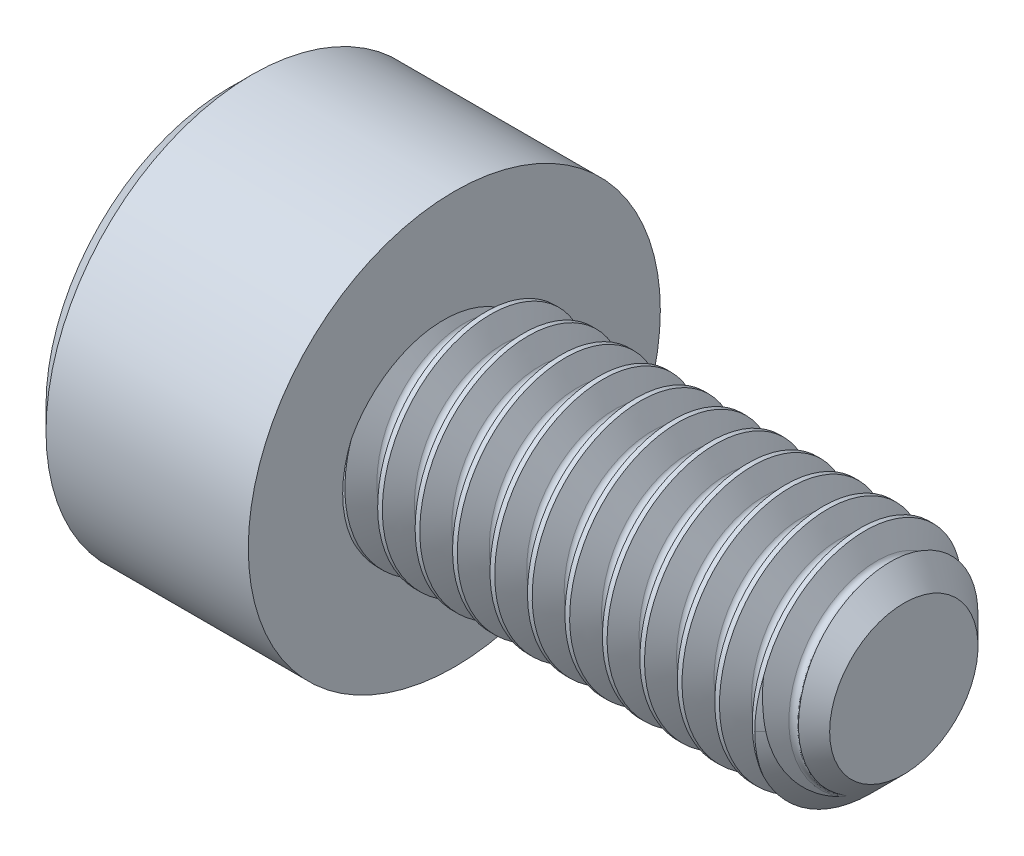
from build123d import *

# Parameters (mm, degrees)
CHAMFER1_SIZE      = 0.5
CHAMFER2_SIZE      = 0.3
CUT_EXTRUDE1_DEPTH = 2.5
CHAMFER3_SIZE      = 0.3
CUT_SWEEP1_PITCH   = 0.5
CUT_SWEEP1_TO      = 6


with BuildPart() as part:
    # Sketch1 → Revolve1 (revolve)
    with BuildSketch(Plane.XY, mode=Mode.PRIVATE) as revolve1_sk:
        Polygon((0, 0), (0, 2.75), (3, 2.75), (3, 1.49), (9, 1.49), (9, 0), align=None)
    revolve(revolve1_sk.sketch.rotate(Axis((-88.705490849, 0, 0), (1, 0, 0)), 90), axis=Axis((-88.705490849, 0, 0), (1, 0, 0)))

    # Chamfer1
    chamfer1_edges = [part.edges().sort_by_distance(p)[0] for p in [
        (9, 0, -1.49),
    ]]
    chamfer(chamfer1_edges, length=CHAMFER1_SIZE)

    # Chamfer2
    chamfer2_edges = [part.edges().sort_by_distance(p)[0] for p in [
        (0, 0, -2.75),
    ]]
    chamfer(chamfer2_edges, length=CHAMFER2_SIZE)

    # Sketch3 → Cut-Extrude1 (cut)
    with BuildSketch(Plane(origin=(0, 0, 0), x_dir=(0, 0, -1), z_dir=(1, 0, 0))):
        Polygon((-1.443375673, 0), (-0.721687836, -1.25), (0.721687836, -1.25), (1.443375673, 0), (0.721687836, 1.25), (-0.721687836, 1.25), align=None)
    extrude(amount=CUT_EXTRUDE1_DEPTH, mode=Mode.SUBTRACT)

    # Chamfer3
    chamfer3_edges = [part.edges().sort_by_distance(p)[0] for p in [
        (0, 0.625, 1.082531755),
        (0, -0.625, 1.082531755),
        (0, -1.25, 0),
        (0, -0.625, -1.082531755),
        (0, 0.625, -1.082531755),
        (0, 1.25, 0),
    ]]
    chamfer(chamfer3_edges, length=CHAMFER3_SIZE)

    # Cut-Sweep1: arcs per turn and ends read off the stored shape
    # Cut-Sweep1: the profile of Sketch8 screwed along a right-hand helix through 13 turns, 6 arcs to a turn; built about Z, then put on its axis
    cut_sweep1_z = Axis((0, 0, 0), (0, 0, 1))
    cut_sweep1_corners = [(1.219375, 0, -0.062498167), (1.6794375, 0, -0.328115375), (1.6794375, 0, 0.328115375), (1.219375, 0, 0.062498167), (1.183291667, 0, 0)]
    with BuildLine(mode=Mode.PRIVATE) as cut_sweep1_profile:
        Line(cut_sweep1_corners[0], cut_sweep1_corners[1])
        Line(cut_sweep1_corners[1], cut_sweep1_corners[2])
        Line(cut_sweep1_corners[2], cut_sweep1_corners[3])
        ThreePointArc((1.219375, 0, 0.062498167), (1.192960167, 0, 0.036083333), (1.183291667, 0, 0))
        ThreePointArc((1.183291667, 0, 0), (1.192960167, 0, -0.036083333), (1.219375, 0, -0.062498167))
    cut_sweep1_cap = Face(cut_sweep1_profile.wire())
    cut_sweep1_arcs = [((1.219375, 0, 0.062498167), (1.183291667, 0, 0.041665444), (1.183291667, 0, 0), (1, 0.8660254037844317, 1)), ((1.183291667, 0, 0), (1.183291667, 0, -0.041665444), (1.219375, 0, -0.062498167), (1, 0.8660254037844317, 1))]  # start, shoulder, end, weights
    cut_sweep1_turn_angles = [0, 30, 60, 90, 120, 150, 180, 210, 240, 270, 300, 330, 360]
    cut_sweep1_turn_weights = [1, 0.8660254037844387, 1, 0.8660254037844387, 1, 0.8660254037844387, 1, 0.8660254037844387, 1, 0.8660254037844387, 1, 0.8660254037844387, 1]
    cut_sweep1_turn_rails = [Edge.make_bspline([Vector(p[0], p[1], 0).rotate(cut_sweep1_z, cut_sweep1_turn_angles[k]) / cut_sweep1_turn_weights[k] + Vector(0, 0, p[2] + CUT_SWEEP1_PITCH * cut_sweep1_turn_angles[k] / 360) for k in range(13)], [0, 0, 0, 1, 1, 2, 2, 3, 3, 4, 4, 5, 5, 6, 6, 6], 2, cut_sweep1_turn_weights) for p in cut_sweep1_corners]
    cut_sweep1_turn_sides = [*[Face.make_surface_from_curves(cut_sweep1_turn_rails[p[0]], cut_sweep1_turn_rails[p[1]]) for p in [(0, 1), (1, 2), (2, 3)]], *[Face.make_bezier_surface([[Vector(p[j][0], p[j][1], 0).rotate(cut_sweep1_z, cut_sweep1_turn_angles[2 * i + k]) / cut_sweep1_turn_weights[2 * i + k] + Vector(0, 0, p[j][2] + CUT_SWEEP1_PITCH * cut_sweep1_turn_angles[2 * i + k] / 360) for k in range(3)] for j in range(3)], [[p[3][j] * cut_sweep1_turn_weights[2 * i + k] for k in range(3)] for j in range(3)]) for p in cut_sweep1_arcs for i in range(6)]]
    cut_sweep1_turn = Solid(Shell([*cut_sweep1_turn_sides, cut_sweep1_cap, cut_sweep1_cap.rotate(cut_sweep1_z, 360).moved(Location((0, 0, CUT_SWEEP1_PITCH * 360 / 360)))]))
    cut_sweep1_each = [*[cut_sweep1_turn.moved(Location((0, 0, CUT_SWEEP1_PITCH * i))) for i in range(13)]]
    add(Plane(origin=(9, 0, 0), x_dir=(0, 0, -1), z_dir=(-1, 0, 0)) * split(Compound([cut_sweep1_each[i] for i in range(0, 13, 2)]), bisect_by=Plane.XY.offset(CUT_SWEEP1_TO), keep=Keep.BOTTOM, mode=Mode.PRIVATE), mode=Mode.SUBTRACT)
    add(Plane(origin=(9, 0, 0), x_dir=(0, 0, -1), z_dir=(-1, 0, 0)) * split(Compound([cut_sweep1_each[i] for i in range(1, 13, 2)]), bisect_by=Plane.XY.offset(CUT_SWEEP1_TO), keep=Keep.BOTTOM, mode=Mode.PRIVATE), mode=Mode.SUBTRACT)


solid = part.part
